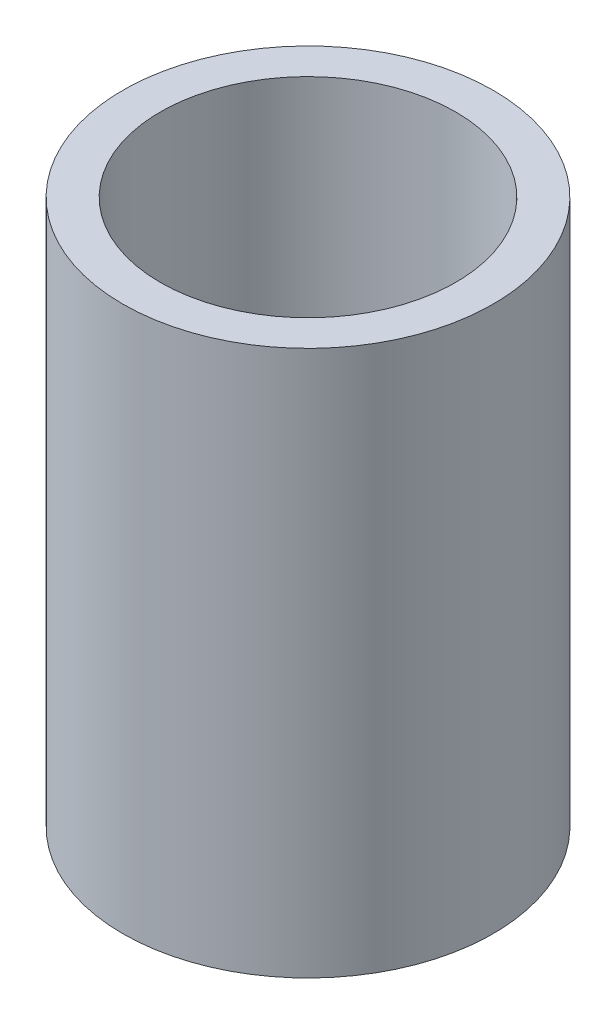
from build123d import *

# Parameters (mm, degrees)
SKETCH1_R           = 27.5
BOSS_EXTRUDE1_DEPTH = 80.971109409
SKETCH2_R           = 21.932398252
CUT_EXTRUDE1_DEPTH  = 90.826613867


with BuildPart() as part:
    # Sketch1 → Boss-Extrude1 (new body)
    with BuildSketch(Plane(origin=(0, 0, 0), x_dir=(1, 0, 0), z_dir=(0, 1, 0))):
        Circle(SKETCH1_R)
    extrude(amount=BOSS_EXTRUDE1_DEPTH)

    # Sketch2 → Cut-Extrude1 (cut, through all)
    with BuildSketch(Plane(origin=(0, 0, 0), x_dir=(1, 0, 0), z_dir=(0, 1, 0))):
        Circle(SKETCH2_R)
    extrude(amount=CUT_EXTRUDE1_DEPTH, mode=Mode.SUBTRACT)


solid = part.part
